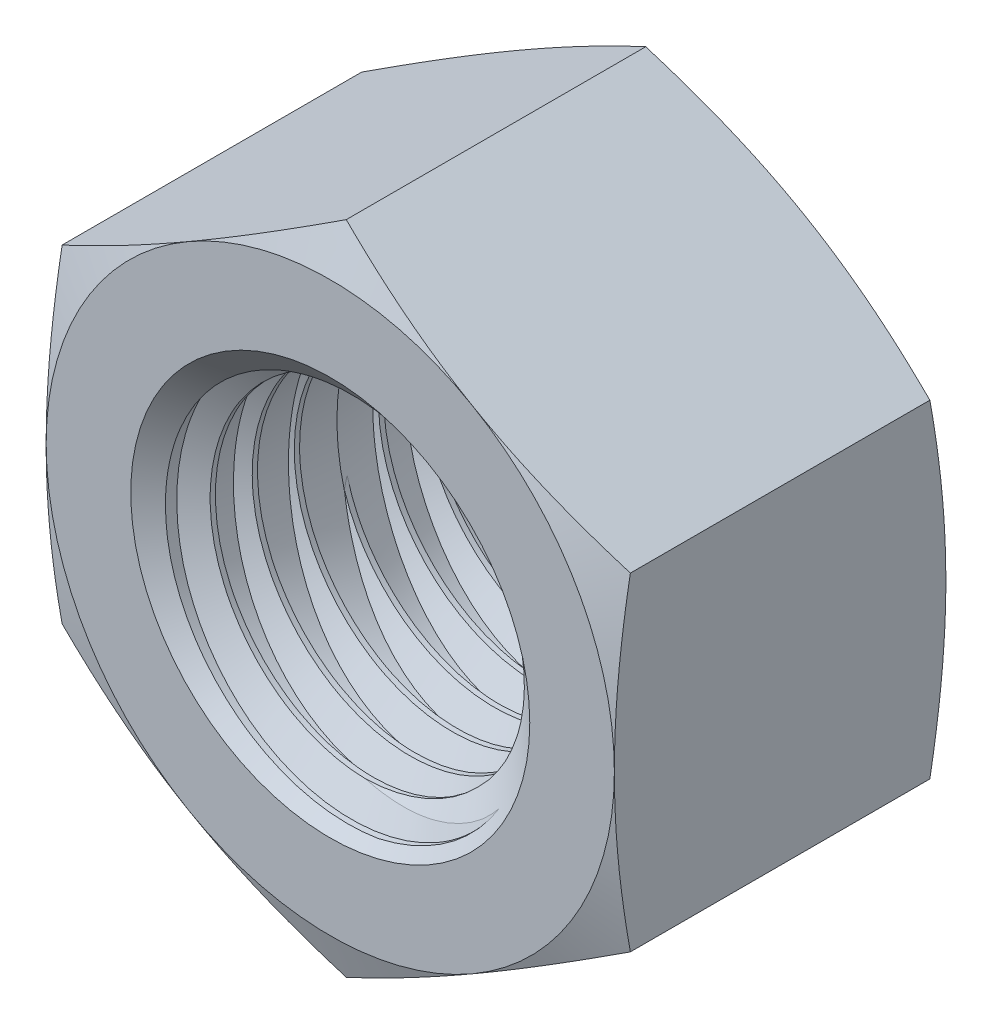
from build123d import *

# Parameters (mm, degrees)
EXTRUDE1_DEPTH      = 4.1671875
SKETCH2_OUTSIDE_W   = 101.906
SKETCH2_OUTSIDE_H   = 104.116
SKETCH2_OUTSIDE_R   = 7.14375
CUT_EXTRUDE1_DEPTH  = 14.730957339
CUT_EXTRUDE1_DRAFT  = -70
SKETCH3_OUTSIDE_W   = 101.906
SKETCH3_OUTSIDE_H   = 104.116
SKETCH3_OUTSIDE_R   = 7.14375
CUT_EXTRUDE2_DEPTH  = 14.730957339
CUT_EXTRUDE2_DRAFT  = -70
SWEEP1_PITCH        = 1.058333333
CUT_EXTRUDE4_DEPTH  = 29.620286377
CUT_EXTRUDE5_DEPTH  = 22.155501732
SKETCH13_R          = 5.0165
CUT_EXTRUDE8_DEPTH  = 2.116666667
CUT_EXTRUDE8_DRAFT  = -50
SKETCH14_R          = 5.0165
CUT_EXTRUDE9_DEPTH  = 2.116666667
CUT_EXTRUDE9_DRAFT  = -50
SKETCH16_R          = 2.08359375
CUT_EXTRUDE10_DEPTH = 0.508


with BuildPart() as part:
    # Sketch1 → Extrude1 (new, symmetric)
    with BuildSketch(Plane.XY):
        Polygon((7.14375, -4.124445986), (7.14375, 4.124445986), (0, 8.248891971), (-7.14375, 4.124445986), (-7.14375, -4.124445986), (0, -8.248891971), align=None)
    extrude(amount=EXTRUDE1_DEPTH, both=True)


with BuildPart() as cut_extrude1_tool:
    # Sketch2 outside → Cut-Extrude1 (with draft: the straight prism first)
    with BuildSketch(Plane.XY.offset(4.1671875)):
        Rectangle(SKETCH2_OUTSIDE_W, SKETCH2_OUTSIDE_H)
        Circle(SKETCH2_OUTSIDE_R, mode=Mode.SUBTRACT)
    extrude(amount=-CUT_EXTRUDE1_DEPTH)
    # Cut-Extrude1: the draft: its side faces are tilted about the plane it starts from
    cut_extrude1_sides = [cut_extrude1_tool.faces().sort_by_distance(p)[0] for p in [
        (0, -52.058, -3.19829117),
        (50.953, 0, -3.19829117),
        (0, 52.058, -3.19829117),
        (-50.953, 0, -3.19829117),
        (-7.14375, 0, -3.19829117),
    ]]
    draft(cut_extrude1_sides, Plane.XY.offset(4.1671875), CUT_EXTRUDE1_DRAFT)


with BuildPart() as part_1:
    add(part.part)

    # Cut-Extrude1: cut by cut_extrude1_tool
    add(cut_extrude1_tool.part, mode=Mode.SUBTRACT)


with BuildPart() as cut_extrude2_tool:
    # Sketch3 outside → Cut-Extrude2 (with draft: the straight prism first)
    with BuildSketch(Plane(origin=(0, 0, -4.1671875), x_dir=(-1, 0, 0), z_dir=(0, 0, -1))):
        Rectangle(SKETCH3_OUTSIDE_W, SKETCH3_OUTSIDE_H)
        Circle(SKETCH3_OUTSIDE_R, mode=Mode.SUBTRACT)
    extrude(amount=-CUT_EXTRUDE2_DEPTH)
    # Cut-Extrude2: the draft: its side faces are tilted about the plane it starts from
    cut_extrude2_sides = [cut_extrude2_tool.faces().sort_by_distance(p)[0] for p in [
        (0, -52.058, 3.19829117),
        (-50.953, 0, 3.19829117),
        (0, 52.058, 3.19829117),
        (50.953, 0, 3.19829117),
        (7.14375, 0, 3.19829117),
    ]]
    draft(cut_extrude2_sides, Plane(origin=(0, 0, -4.1671875), x_dir=(-1, 0, 0), z_dir=(0, 0, -1)), CUT_EXTRUDE2_DRAFT)


with BuildPart() as part_2:
    add(part_1.part)

    # Cut-Extrude2: cut by cut_extrude2_tool
    add(cut_extrude2_tool.part, mode=Mode.SUBTRACT)

    # Cut-Loft1: read off the stored shape, not the designer's step
    # Cut-Loft1: loft between two sections, ruled curve by curve
    cut_loft1_from = [
        Edge.make_bspline([(4.338091874, -1.96529009, -4.1671875), (8.268672055, 6.710893659, -4.1671875), (-0.407511694, 10.641473839, -4.1671875), (-4.338091874, 1.96529009, -4.1671875), (-8.268672055, -6.710893659, -4.1671875), (0.407511694, -10.641473839, -4.1671875), (4.338091874, -1.96529009, -4.1671875)], [0, 0, 0, 0, 0.5, 0.5, 0.5, 1, 1, 1, 1], 3, [1, 0.333333333, 0.333333333, 1, 0.333333333, 0.333333333, 1]),
    ]
    cut_loft1_to = [
        Edge.make_bspline([(3.951247207, -0.74501914, 0), (5.202879361, 8.662712304, 0), (-2.699615052, 10.152750584, 0), (-3.951247207, 0.74501914, 0), (-5.202879361, -8.662712304, 0), (2.699615052, -10.152750584, 0), (3.951247207, -0.74501914, 0)], [0, 0, 0, 0, 0.5, 0.5, 0.5, 1, 1, 1, 1], 3, [1, 0.333333333, 0.333333333, 1, 0.333333333, 0.333333333, 1]),
    ]
    cut_loft1 = Solid(Shell([*[Face.make_surface_from_curves(cut_loft1_from[k], cut_loft1_to[k]) for k in range(1)], Face(Wire(cut_loft1_from)), Face(Wire(cut_loft1_to))]))
    add(cut_loft1, mode=Mode.SUBTRACT)

    # Mirror1: Cut-Loft1 across plane
    add(cut_loft1.mirror(Plane.XY), mode=Mode.SUBTRACT)

    # Sweep1: arcs per turn and ends read off the stored shape
    # Sweep1: the profile of Sketch9 screwed along a right-hand helix through 25 turns, 6 arcs to a turn; built about Z, then put on its axis
    sweep1_z = Axis((0, 0, 0), (0, 0, 1))
    sweep1_corners = [(4.7625, 0, 0), (4.7625, 0, -0.926041667), (4.075092336, 0, -0.529166667), (4.075092336, 0, -0.396875)]
    with BuildLine(mode=Mode.PRIVATE) as sweep1_profile:
        Line(sweep1_corners[0], sweep1_corners[1])
        Line(sweep1_corners[1], sweep1_corners[2])
        Line(sweep1_corners[2], sweep1_corners[3])
        Line(sweep1_corners[3], sweep1_corners[0])
    sweep1_cap = Face(sweep1_profile.wire())
    sweep1_turn_angles = [0, 30, 60, 90, 120, 150, 180, 210, 240, 270, 300, 330, 360]
    sweep1_turn_weights = [1, 0.8660254037844387, 1, 0.8660254037844387, 1, 0.8660254037844387, 1, 0.8660254037844387, 1, 0.8660254037844387, 1, 0.8660254037844387, 1]
    sweep1_turn_rails = [Edge.make_bspline([Vector(p[0], p[1], 0).rotate(sweep1_z, sweep1_turn_angles[k]) / sweep1_turn_weights[k] + Vector(0, 0, p[2] + SWEEP1_PITCH * sweep1_turn_angles[k] / 360) for k in range(13)], [0, 0, 0, 1, 1, 2, 2, 3, 3, 4, 4, 5, 5, 6, 6, 6], 2, sweep1_turn_weights) for p in sweep1_corners]
    sweep1_turn_sides = [Face.make_surface_from_curves(sweep1_turn_rails[p[0]], sweep1_turn_rails[p[1]]) for p in [(0, 1), (1, 2), (2, 3), (3, 0)]]
    sweep1 = Plane(origin=(0, 0, -4.1671875), x_dir=(0, 1, 0), z_dir=(0, 0, 1)) * Solid(Shell([*[p.moved(Location((0, 0, SWEEP1_PITCH * i))) for i in range(25) for p in sweep1_turn_sides], sweep1_cap, sweep1_cap.rotate(sweep1_z, 9000).moved(Location((0, 0, SWEEP1_PITCH * 9000 / 360)))]))
    add(sweep1)

    # Sketch10 → Cut-Extrude4 (cut, through all)
    with BuildSketch(Plane(origin=(0, 0, -4.1671875), x_dir=(-1, 0, 0), z_dir=(0, 0, -1))):
        Polygon((-7.14375, 4.124445986), (-7.14375, -4.124445986), (0, -8.248891971), (7.14375, -4.124445986), (7.14375, 4.124445986), (0, 8.248891971), align=None)
    extrude(amount=CUT_EXTRUDE4_DEPTH, mode=Mode.SUBTRACT)

    # Sketch11 → Cut-Extrude5 (cut, through all)
    with BuildSketch(Plane.XY.offset(4.1671875)):
        with BuildLine():
            ThreePointArc((3.571875, -6.186668978), (6.186668978, -3.571875), (7.14375, 0))
            ThreePointArc((7.14375, 0), (6.186668978, 3.571875), (3.571875, 6.186668978))
            ThreePointArc((3.571875, 6.186668978), (0, 7.14375), (-3.571875, 6.186668978))
            ThreePointArc((-3.571875, 6.186668978), (-6.186668978, 3.571875), (-7.14375, 0))
            ThreePointArc((-7.14375, 0), (-6.186668978, -3.571875), (-3.571875, -6.186668978))
            ThreePointArc((-3.571875, -6.186668978), (0, -7.14375), (3.571875, -6.186668978))
        make_face()
    extrude(amount=CUT_EXTRUDE5_DEPTH, mode=Mode.SUBTRACT)


with BuildPart() as cut_extrude8_tool:
    # Sketch13 → Cut-Extrude8 (with draft: the straight prism first)
    with BuildSketch(Plane.XY.offset(4.1671875)):
        Circle(SKETCH13_R)
    extrude(amount=-CUT_EXTRUDE8_DEPTH)
    # Cut-Extrude8: the draft: its side faces are tilted about the plane it starts from
    cut_extrude8_sides = [cut_extrude8_tool.faces().sort_by_distance(p)[0] for p in [
        (-5.0165, 0, 3.108854167),
    ]]
    draft(cut_extrude8_sides, Plane.XY.offset(4.1671875), CUT_EXTRUDE8_DRAFT)


with BuildPart() as part_3:
    add(part_2.part)

    # Cut-Extrude8: cut by cut_extrude8_tool
    add(cut_extrude8_tool.part, mode=Mode.SUBTRACT)


with BuildPart() as cut_extrude9_tool:
    # Sketch14 → Cut-Extrude9 (with draft: the straight prism first)
    with BuildSketch(Plane(origin=(0, 0, -4.1671875), x_dir=(-1, 0, 0), z_dir=(0, 0, -1))):
        Circle(SKETCH14_R)
    extrude(amount=-CUT_EXTRUDE9_DEPTH)
    # Cut-Extrude9: the draft: its side faces are tilted about the plane it starts from
    cut_extrude9_sides = [cut_extrude9_tool.faces().sort_by_distance(p)[0] for p in [
        (5.0165, 0, -3.108854167),
    ]]
    draft(cut_extrude9_sides, Plane(origin=(0, 0, -4.1671875), x_dir=(-1, 0, 0), z_dir=(0, 0, -1)), CUT_EXTRUDE9_DRAFT)


with BuildPart() as part_4:
    add(part_3.part)

    # Cut-Extrude9: cut by cut_extrude9_tool
    add(cut_extrude9_tool.part, mode=Mode.SUBTRACT)

    # Sketch16 → Cut-Extrude10 (cut)
    with BuildSketch(Plane.ZY.offset(7.14375)):
        Circle(SKETCH16_R)
    extrude(amount=-CUT_EXTRUDE10_DEPTH, mode=Mode.SUBTRACT)


solid = part_4.part
